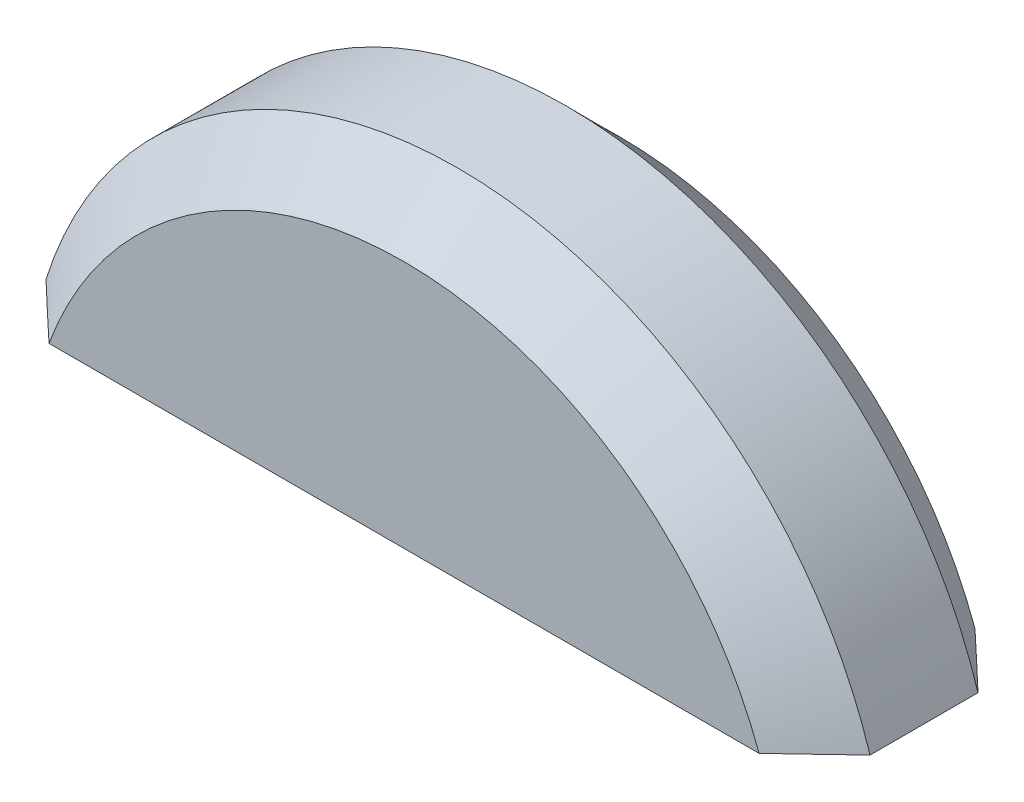
from build123d import *

# Parameters (mm, degrees)
EXTRUDE1_DEPTH = 1
CHAMFER1_SIZE  = 0.25


with BuildPart() as part:
    # body → Extrude1 (new body)
    with BuildSketch(Plane.XY):
        with BuildLine():
            Line((-1.907878403, 0.6), (1.907878403, 0.6))
            ThreePointArc((1.907878403, 0.6), (0, 2), (-1.907878403, 0.6))
        make_face()
    extrude(amount=EXTRUDE1_DEPTH)

    # Chamfer1
    chamfer1_edges = [part.edges().sort_by_distance(p)[0] for p in [
        (0, 2, 1),
        (0, 2, 0),
    ]]
    chamfer(chamfer1_edges, length=CHAMFER1_SIZE)


solid = part.part
